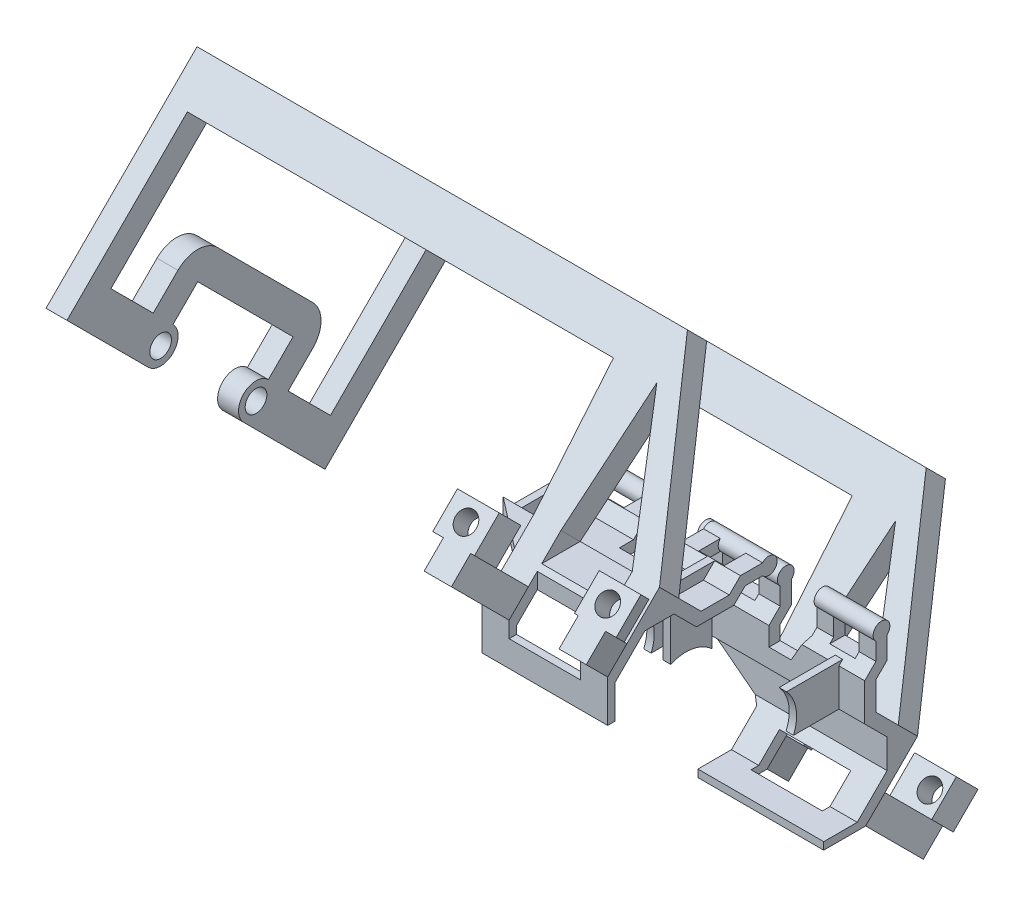
from build123d import *
from build123d.topology import SkipClean

# Parameters (mm, degrees)
BOSS_EXTRUDE1_DEPTH             = 25.12
CUT_EXTRUDE1_REACH              = 38.515
CUT_EXTRUDE2_REACH              = 38.515
SKETCH2_W                       = 10.2
SKETCH2_H                       = 2.969848481
CUT_EXTRUDE3_REACH              = 38.515
SKETCH4_W                       = 10.2
SKETCH4_H                       = 3.36
CUT_EXTRUDE5_REACH              = 38.08
SKETCH5_W                       = 3.64
SKETCH5_H                       = 2.76
SKETCH5_W_2                     = 5.2
SKETCH8_W                       = 3.64
SKETCH8_H                       = 0.507084972
SKETCH8_W_2                     = 5.2
CUT_EXTRUDE6_REACH              = 38.08
CUT_EXTRUDE6_DIRECTION_2_REACH  = 38.08
BOSS_EXTRUDE2_REACH             = 38.08
SKETCH10_W                      = 1.06
SKETCH10_H                      = 7.233095244
BOSS_EXTRUDE3_REACH             = 37.412
SKETCH11_W                      = 1.06
SKETCH11_H                      = 5.895836944
BOSS_EXTRUDE3_DIRECTION_2_DEPTH = 10
CUT_EXTRUDE7_REACH              = 36.082
SKETCH12_R                      = 5.5
BOSS_EXTRUDE5_REACH             = 39.854
SKETCH17_W                      = 3.9
SKETCH17_H                      = 3.889087297
SIDESENSHOLD_DEPTH              = 3.889087297
BOSS_EXTRUDE7_DEPTH             = 5
SKETCH28_R                      = 1.5
CUT_EXTRUDE10_DEPTH             = 3
EXTENDBACK_DEPTH                = 60.97
BOSS_EXTRUDE9_DEPTH             = 3
CROSSBEAM_DEPTH                 = 3
BACKSENSHOLES_REACH             = 114.715
SKETCH21_R                      = 1.55
CUT_EXTRUDE9_REACH              = 114.715
BOSS_EXTRUDE6_DEPTH             = 3


with BuildPart() as part:
    # Sketch1 → Boss-Extrude1 (new body)
    with BuildSketch(Plane(origin=(0, 0, 0), x_dir=(0, 0, -1), z_dir=(1, 0, 0))):
        with BuildLine():
            Line((0, 0), (6, 0))
            Line((6, 0), (10.666904756, 4.666904756))
            Line((10.666904756, 4.666904756), (10.666904756, 10.166904756))
            Line((10.666904756, 10.166904756), (7.466904756, 13.366904756))
            Line((7.466904756, 13.366904756), (7.466904756, 17.4))
            Line((7.466904756, 17.4), (9.066904756, 19))
            Line((9.066904756, 19), (9.066904756, 22.165572809))
            ThreePointArc((9.066904756, 22.165572809), (8.266904756, 24.26), (7.466904756, 22.165572809))
            Line((7.466904756, 22.165572809), (7.466904756, 19.6627417))
            Line((7.466904756, 19.6627417), (5.866904756, 18.0627417))
            Line((5.866904756, 18.0627417), (5.866904756, 12.704163056))
            Line((5.866904756, 12.704163056), (9.066904756, 9.504163056))
            Line((9.066904756, 9.504163056), (9.066904756, 5.329646456))
            Line((9.066904756, 5.329646456), (4.7972583, 1.06))
            Line((4.7972583, 1.06), (0, 1.06))
            Line((0, 1.06), (0, 0))
        make_face()
    extrude(amount=BOSS_EXTRUDE1_DEPTH)

    # Sketch3 → Cut-Extrude1 (cut, up to next)
    with BuildSketch(Plane(origin=(0, 0, -10.666904756), x_dir=(-1, 0, 0), z_dir=(0, 0, -1)), mode=Mode.PRIVATE) as cut_extrude1_sk1:
        Polygon((0, 10.166904756), (-7.12, 4.666904756), (-7.12, 0), (0, 0), align=None)
    cut_extrude1_tool1 = extrude(cut_extrude1_sk1.sketch, amount=-CUT_EXTRUDE1_REACH, mode=Mode.PRIVATE) & part.part
    add(cut_extrude1_tool1.solids().sort_by_distance((3.120014, 3.878391, -10.666905))[0], mode=Mode.SUBTRACT)

    # Cut-Extrude2: up to this plane
    cut_extrude2_end = Plane(origin=(25.12, 0, -6), z_dir=(0, 0.7071067811865465, 0.7071067811865487))
    # Sketch2 → Cut-Extrude2 (cut, up to the surface)
    with BuildSketch(Plane.XY, mode=Mode.PRIVATE) as cut_extrude2_sk1:
        with Locations((16.12, 2.544924241)):
            Rectangle(SKETCH2_W, SKETCH2_H)
    cut_extrude2_tool1 = split(extrude(cut_extrude2_sk1.sketch, amount=-CUT_EXTRUDE2_REACH, mode=Mode.PRIVATE), bisect_by=cut_extrude2_end, keep=Keep.BOTH, mode=Mode.PRIVATE)
    add(cut_extrude2_tool1.solids().sort_by_distance((16.12, 2.544924, 0))[0], mode=Mode.SUBTRACT)

    # Sketch4 → Cut-Extrude3 (cut, up to next)
    with BuildSketch(Plane.XZ, mode=Mode.PRIVATE) as cut_extrude3_sk1:
        with Locations((16.12, -5.38)):
            Rectangle(SKETCH4_W, SKETCH4_H)
    cut_extrude3_tool1 = extrude(cut_extrude3_sk1.sketch, amount=-CUT_EXTRUDE3_REACH, mode=Mode.PRIVATE) & part.part
    add(cut_extrude3_tool1.solids().sort_by_distance((16.12, 0, -5.38))[0], mode=Mode.SUBTRACT)

    # Sketch5 → Cut-Extrude5 (cut, up to next)
    with BuildSketch(Plane(origin=(0, 0, -9.066904756), x_dir=(-1, 0, 0), z_dir=(0, 0, -1)), mode=Mode.PRIVATE) as cut_extrude5_sk1:
        with Locations((-20.9, 20.48)):
            Rectangle(SKETCH5_W, SKETCH5_H)
    cut_extrude5_tool1 = extrude(cut_extrude5_sk1.sketch, amount=-CUT_EXTRUDE5_REACH, mode=Mode.PRIVATE) & part.part
    # Sketch5 → Cut-Extrude5 (cut, up to next)
    with BuildSketch(Plane(origin=(0, 0, -9.066904756), x_dir=(-1, 0, 0), z_dir=(0, 0, -1)), mode=Mode.PRIVATE) as cut_extrude5_sk2:
        with Locations((-5.76, 20.48)):
            Rectangle(SKETCH5_W_2, SKETCH5_H)
    cut_extrude5_tool2 = extrude(cut_extrude5_sk2.sketch, amount=-CUT_EXTRUDE5_REACH, mode=Mode.PRIVATE) & part.part
    add(cut_extrude5_tool1.solids().sort_by_distance((20.9, 20.48, -9.066905))[0], mode=Mode.SUBTRACT)
    add(cut_extrude5_tool2.solids().sort_by_distance((5.76, 20.48, -9.066905))[0], mode=Mode.SUBTRACT)

    # Sketch8 → Cut-Revolve7 (revolve, cut)
    with SkipClean():  # the faces are left unmerged after this step: merging them gives an invalid solid
        with BuildSketch(Plane(origin=(0, 0, -8.266904756), x_dir=(-1, 0, 0), z_dir=(0, 0, -1)), mode=Mode.PRIVATE) as cut_revolve7_sk:
            with Locations((-20.9, 21.606457514)):
                Rectangle(SKETCH8_W, SKETCH8_H)
            with Locations((-5.76, 21.606457514)):
                Rectangle(SKETCH8_W_2, SKETCH8_H)
        revolve(cut_revolve7_sk.sketch.rotate(Axis((25.12, 23.06, -8.266904756), (-1, 0, 0)), 41.810314896), axis=Axis((25.12, 23.06, -8.266904756), (-1, 0, 0)), mode=Mode.SUBTRACT)
    add(part.part.scale(1), mode=Mode.REPLACE)  # the faces are merged on a copy

    # Sketch9 → Cut-Extrude6 (cut, up to next)
    with BuildSketch(Plane(origin=(0, 0, -9.066904756), x_dir=(-1, 0, 0), z_dir=(0, 0, -1)), mode=Mode.PRIVATE) as cut_extrude6_sk1:
        Polygon((-16.68, 19), (-16.68, 24.26), (-11.42, 24.26), (-11.42, 15.383452378), (-14.591985257, 15.383452378), align=None)
    cut_extrude6_tool1 = extrude(cut_extrude6_sk1.sketch, amount=-CUT_EXTRUDE6_REACH, mode=Mode.PRIVATE) & part.part
    add(cut_extrude6_tool1.solids().sort_by_distance((13.879845, 20.106148, -9.066905))[0], mode=Mode.SUBTRACT)

    # Sketch9 → Cut-Extrude6 direction 2 (cut, up to next)
    with BuildSketch(Plane(origin=(0, 0, -9.066904756), x_dir=(-1, 0, 0), z_dir=(0, 0, -1)), mode=Mode.PRIVATE) as cut_extrude6_direction_2_sk1:
        Polygon((-16.68, 19), (-16.68, 24.26), (-11.42, 24.26), (-11.42, 15.383452378), (-14.591985257, 15.383452378), align=None)
    cut_extrude6_direction_2_tool1 = extrude(cut_extrude6_direction_2_sk1.sketch, amount=CUT_EXTRUDE6_DIRECTION_2_REACH, mode=Mode.PRIVATE) & part.part
    add(cut_extrude6_direction_2_tool1.solids().sort_by_distance((13.879845, 20.106148, -9.066905))[0], mode=Mode.SUBTRACT)

    # Sketch10 → Boss-Extrude2 (add, up to next)
    with BuildSketch(Plane(origin=(0, 0, -9.066904756), x_dir=(-1, 0, 0), z_dir=(0, 0, -1)), mode=Mode.PRIVATE) as boss_extrude2_sk1:
        with Locations((-20.9, 15.383452378)):
            Rectangle(SKETCH10_W, SKETCH10_H)
    boss_extrude2_tool1 = extrude(boss_extrude2_sk1.sketch, amount=-BOSS_EXTRUDE2_REACH, mode=Mode.PRIVATE) - part.part
    # Sketch10 → Boss-Extrude2 (add, up to next)
    with BuildSketch(Plane(origin=(0, 0, -9.066904756), x_dir=(-1, 0, 0), z_dir=(0, 0, -1)), mode=Mode.PRIVATE) as boss_extrude2_sk2:
        with Locations((-0.53, 15.383452378)):
            Rectangle(SKETCH10_W, SKETCH10_H)
    boss_extrude2_tool2 = extrude(boss_extrude2_sk2.sketch, amount=-BOSS_EXTRUDE2_REACH, mode=Mode.PRIVATE) - part.part
    add(boss_extrude2_tool1.solids().sort_by_distance((20.9, 15.383452, -9.066905))[0])
    add(boss_extrude2_tool2.solids().sort_by_distance((0.53, 15.383452, -9.066905))[0])

    # Sketch11 → Boss-Extrude3 (add, up to next)
    with BuildSketch(Plane.XY.offset(-5.866904756), mode=Mode.PRIVATE) as boss_extrude3_sk1:
        with Locations((20.9, 15.652081528)):
            Rectangle(SKETCH11_W, SKETCH11_H)
    boss_extrude3_tool1 = extrude(boss_extrude3_sk1.sketch, amount=-BOSS_EXTRUDE3_REACH, mode=Mode.PRIVATE) - part.part
    # Sketch11 → Boss-Extrude3 (add, up to next)
    with BuildSketch(Plane.XY.offset(-5.866904756), mode=Mode.PRIVATE) as boss_extrude3_sk2:
        with Locations((0.53, 15.652081528)):
            Rectangle(SKETCH11_W, SKETCH11_H)
    boss_extrude3_tool2 = extrude(boss_extrude3_sk2.sketch, amount=-BOSS_EXTRUDE3_REACH, mode=Mode.PRIVATE) - part.part
    add(boss_extrude3_tool1.solids().sort_by_distance((20.9, 15.652082, -5.866905))[0])
    add(boss_extrude3_tool2.solids().sort_by_distance((0.53, 15.652082, -5.866905))[0])

    # Sketch11 → Boss-Extrude3 direction 2 (add)
    with BuildSketch(Plane.XY.offset(-5.866904756)):
        with Locations((20.9, 15.652081528)):
            Rectangle(SKETCH11_W, SKETCH11_H)
        with Locations((0.53, 15.652081528)):
            Rectangle(SKETCH11_W, SKETCH11_H)
    extrude(amount=BOSS_EXTRUDE3_DIRECTION_2_DEPTH)

    # Cut-Extrude7: up to this face of the body (flat: up to its plane)
    cut_extrude7_end = Plane(part.part.faces().sort_by_distance((0, 15.652081528, -0.866904756))[0])
    # Sketch12 → Cut-Extrude7 (cut, up to the picked face)
    with BuildSketch(Plane(origin=(21.43, 0, 0), x_dir=(0, 0, -1), z_dir=(1, 0, 0)), mode=Mode.PRIVATE) as cut_extrude7_sk1:
        with Locations((-5.684345686, 14.880138463)):
            Circle(SKETCH12_R)
    cut_extrude7_tool1 = split(extrude(cut_extrude7_sk1.sketch, amount=-CUT_EXTRUDE7_REACH, mode=Mode.PRIVATE), bisect_by=cut_extrude7_end, keep=Keep.BOTH, mode=Mode.PRIVATE)
    add(cut_extrude7_tool1.solids().sort_by(Axis((21.43, 14.880138, 5.684346), (-1, 0, 0)))[0], mode=Mode.SUBTRACT)

    # Boss-Extrude5: up to this face of the body (flat: up to its plane)
    boss_extrude5_end = Plane(part.part.faces().sort_by_distance((14.242028448, 7.5682653, -10.666904756))[0])
    # Sketch17 → Boss-Extrude5 (add, up to the picked face)
    with BuildSketch(Plane(origin=(0, -3, -3), x_dir=(1, 0, 0), z_dir=(0, -0.7071067811865465, -0.7071067811865486)), mode=Mode.PRIVATE) as boss_extrude5_sk1:
        with Locations((9.07, -12.787184336)):
            Rectangle(SKETCH17_W, SKETCH17_H)
    boss_extrude5_tool1 = split(extrude(boss_extrude5_sk1.sketch, amount=-BOSS_EXTRUDE5_REACH, mode=Mode.PRIVATE), bisect_by=boss_extrude5_end, keep=Keep.BOTH, mode=Mode.PRIVATE)
    # Sketch17 → Boss-Extrude5 (add, up to the picked face)
    with BuildSketch(Plane(origin=(0, -3, -3), x_dir=(1, 0, 0), z_dir=(0, -0.7071067811865465, -0.7071067811865486)), mode=Mode.PRIVATE) as boss_extrude5_sk2:
        with Locations((23.17, -12.787184336)):
            Rectangle(SKETCH17_W, SKETCH17_H)
    boss_extrude5_tool2 = split(extrude(boss_extrude5_sk2.sketch, amount=-BOSS_EXTRUDE5_REACH, mode=Mode.PRIVATE), bisect_by=boss_extrude5_end, keep=Keep.BOTH, mode=Mode.PRIVATE)
    add(boss_extrude5_tool1.solids().sort_by(Axis((9.07, 6.041905, -12.041905), (0, 0.7071067811865465, 0.7071067811865486)))[0])
    add(boss_extrude5_tool2.solids().sort_by(Axis((23.17, 6.041905, -12.041905), (0, 0.7071067811865465, 0.7071067811865486)))[0])

    # Sketch15 → SideSensHold (add)
    with BuildSketch(Plane(origin=(0, -3, -3), x_dir=(1, 0, 0), z_dir=(0, -0.7071067811865465, -0.7071067811865486))):
        Polygon((7.12, -14.731727984), (11.02, -14.731727984), (12.17, -32.501466786), (21.22, -14.731727984), (25.12, -14.731727984), (12.17, -38.701466786), (5.97, -38.701466786), (5.97, -32.501466786), align=None)
    extrude(amount=-SIDESENSHOLD_DEPTH)

    # Sketch26 → Loft1 section 0
    with BuildSketch(Plane(origin=(0, -3, -3), x_dir=(-1, 0, 0), z_dir=(0, -0.7071067811865465, -0.7071067811865486))):
        with BuildLine():
            Line((-25.12, 4.242640687), (-21.22, 4.242640687))
            Line((-21.22, 4.242640687), (-21.22, 8.142640687))
            Line((-21.22, 8.142640687), (-25.12, 8.142640687))
            Line((-25.12, 8.142640687), (-25.12, 4.242640687))
        make_face()
    # Sketch25 → Loft1 section 1
    with BuildSketch(Plane(origin=(0, -8.656854249, -8.656854249), x_dir=(-1, 0, 0), z_dir=(0, -0.7071067811865465, -0.7071067811865486))):
        with BuildLine():
            Line((-27.72, 4.242640687), (-23.82, 4.242640687))
            Line((-23.82, 4.242640687), (-23.82, 8.142640687))
            Line((-23.82, 8.142640687), (-27.72, 8.142640687))
            Line((-27.72, 8.142640687), (-27.72, 4.242640687))
        make_face()
    loft()

    # Sketch26<5> → Loft2 section 0
    with BuildSketch(Plane(origin=(0, -3, -3), x_dir=(-1, 0, 0), z_dir=(0, -0.7071067811865465, -0.7071067811865486))):
        with BuildLine():
            Line((-11.02, 4.242640687), (-7.12, 4.242640687))
            Line((-7.12, 4.242640687), (-7.12, 8.142640687))
            Line((-7.12, 8.142640687), (-11.02, 8.142640687))
            Line((-11.02, 8.142640687), (-11.02, 4.242640687))
        make_face()
    # Sketch25<5> → Loft2 section 1
    with BuildSketch(Plane(origin=(0, -8.656854249, -8.656854249), x_dir=(-1, 0, 0), z_dir=(0, -0.7071067811865465, -0.7071067811865486))):
        with BuildLine():
            Line((-8.42, 4.242640687), (-4.52, 4.242640687))
            Line((-4.52, 4.242640687), (-4.52, 8.142640687))
            Line((-4.52, 8.142640687), (-8.42, 8.142640687))
            Line((-8.42, 8.142640687), (-8.42, 4.242640687))
        make_face()
    loft()

    # Sketch27 → Boss-Extrude7 (add)
    with BuildSketch(Plane(origin=(0, 5.757716447, -5.757716447), x_dir=(1, 0, 0), z_dir=(0, 0.7071067811865483, -0.7071067811865468))):
        Polygon((8.97, 12.242640687), (9.945, 9.242640687), (3.97, 9.242640687), (2.995, 12.242640687), align=None)
    boss_extrude7 = extrude(amount=BOSS_EXTRUDE7_DEPTH)

    # Sketch28 → Cut-Extrude10 (cut)
    with BuildSketch(Plane(origin=(0, -8.656854249, -8.656854249), x_dir=(-1, 0, 0), z_dir=(0, -0.7071067811865467, -0.7071067811865485))):
        with Locations(Location((-5.9825, 10.642640687, 0), (0, 0, 90))):
            Circle(SKETCH28_R)
    cut_extrude10 = extrude(amount=-CUT_EXTRUDE10_DEPTH, mode=Mode.SUBTRACT)

    # Mirror3: Boss-Extrude7, Cut-Extrude10 across plane
    add(boss_extrude7.mirror(Plane.ZY.offset(-16.12)))
    add(cut_extrude10.mirror(Plane.ZY.offset(-16.12)), mode=Mode.SUBTRACT)

    # Sketch18 → ExtendBack (add)
    with BuildSketch(Plane(origin=(5.97, 0, 0), x_dir=(0, 0, -1), z_dir=(1, 0, 0))):
        Polygon((30.366069607, 24.366069607), (27.616069607, 27.116069607), (23.232007563, 22.732007563), (25.982007563, 19.982007563), align=None)
    extrude(amount=-EXTENDBACK_DEPTH)

    # Sketch30 → Boss-Extrude9 (add)
    with BuildSketch(Plane.ZY.offset(55)):
        Polygon((-30.366069607, 24.366069607), (-27.616069607, 27.116069607), (-6.007716447, 5.507716447), (-8.757716447, 2.757716447), align=None)
    extrude(amount=BOSS_EXTRUDE9_DEPTH)

    # Sketch19 → Crossbeam (add)
    with BuildSketch(Plane(origin=(-55, 0, 0), x_dir=(0, 0, -1), z_dir=(1, 0, 0))):
        Polygon((9.543250353, 9.043250353), (6.007716447, 5.507716447), (-9.699848481, 21.215281374), (-6.164314575, 24.75081528), align=None)
    extrude(amount=-CROSSBEAM_DEPTH)


with BuildPart() as body_2:
    # Mirror2: mirrored copy
    add(part.part.mirror(Plane(origin=(0, 15.457564928, 15.457564928), x_dir=(0, -0.7071067811865488, 0.7071067811865462), z_dir=(0, -0.7071067811865465, -0.7071067811865487))))


with BuildPart() as part_1:
    add(part.part)

    # Combine1: union body 2
    add(body_2.part)

    # Sketch21 → BackSensHoles (cut, up to next)
    with BuildSketch(Plane.ZY.offset(58), mode=Mode.PRIVATE) as backsensholes_sk1:
        with Locations((1.10850109, 16.159467889)):
            Circle(SKETCH21_R)
    backsensholes_tool1 = extrude(backsensholes_sk1.sketch, amount=-BACKSENSHOLES_REACH, mode=Mode.PRIVATE) & part_1.part
    # Sketch21 → BackSensHoles (cut, up to next)
    with BuildSketch(Plane.ZY.offset(58), mode=Mode.PRIVATE) as backsensholes_sk2:
        with Locations((14.755661966, 29.806628766)):
            Circle(SKETCH21_R)
    backsensholes_tool2 = extrude(backsensholes_sk2.sketch, amount=-BACKSENSHOLES_REACH, mode=Mode.PRIVATE) & part_1.part
    add(backsensholes_tool1.solids().sort_by_distance((-58, 16.159468, 1.108501))[0], mode=Mode.SUBTRACT)
    add(backsensholes_tool2.solids().sort_by_distance((-58, 29.806629, 14.755662))[0], mode=Mode.SUBTRACT)

    # Sketch24 → Cut-Extrude9 (cut, up to next)
    with BuildSketch(Plane.ZY.offset(58), mode=Mode.PRIVATE) as cut_extrude9_sk1:
        with BuildLine():
            Line((-0.659265863, 17.927234842), (12.987895014, 31.574395719))
            ThreePointArc((12.987895014, 31.574395719), (12.987895014, 28.038861813), (16.523428919, 28.038861813))
            Line((16.523428919, 28.038861813), (2.876268043, 14.391700936))
            ThreePointArc((2.876268043, 14.391700936), (2.876268043, 17.927234842), (-0.659265863, 17.927234842))
        make_face()
    cut_extrude9_tool1 = extrude(cut_extrude9_sk1.sketch, amount=-CUT_EXTRUDE9_REACH, mode=Mode.PRIVATE) & part_1.part
    add(cut_extrude9_tool1.solids().sort_by_distance((-58, 22.983048, 7.932082))[0], mode=Mode.SUBTRACT)


with BuildPart() as cut_extrude9_piece_1:
    # of the separate pieces the step leaves, piece 1, a body of its own (cut_extrude9_pieces)
    add(part_1.part.solids().sort_by_distance((-58, 31.574395719, 12.987895014))[0])



with BuildPart() as cut_extrude9_piece_2:
    # of the separate pieces the step leaves, piece 2, a body of its own (cut_extrude9_pieces)
    add(part_1.part.solids().sort_by_distance((7.12, 0, -6))[0])


with BuildPart() as cut_extrude9_piece_1_1:
    add(cut_extrude9_piece_1.part)

    add(cut_extrude9_piece_2.part)  # Boss-Extrude6 merges Cut-Extrude9 piece 2
    # Sketch22 → Boss-Extrude6 (add)
    with BuildSketch(Plane.ZY.offset(58)):
        with BuildLine():
            Line((-0.659265863, 17.927234842), (-4.194799769, 21.462768748))
            Line((-4.194799769, 21.462768748), (9.452361108, 35.109929625))
            Line((9.452361108, 35.109929625), (12.987895014, 31.574395719))
            Line((12.987895014, 31.574395719), (15.816322138, 34.402822843))
            Line((15.816322138, 34.402822843), (12.280788232, 37.938356749))
            ThreePointArc((12.280788232, 37.938356749), (9.452361108, 39.109929625), (6.623933983, 37.938356749))
            Line((6.623933983, 37.938356749), (-7.023226894, 24.291195872))
            ThreePointArc((-7.023226894, 24.291195872), (-8.194799769, 21.462768748), (-7.023226894, 18.634341623))
            Line((-7.023226894, 18.634341623), (-3.487692988, 15.098807717))
            Line((-3.487692988, 15.098807717), (-0.659265863, 17.927234842))
        make_face()
    extrude(amount=-BOSS_EXTRUDE6_DEPTH)


solid = cut_extrude9_piece_1_1.part
